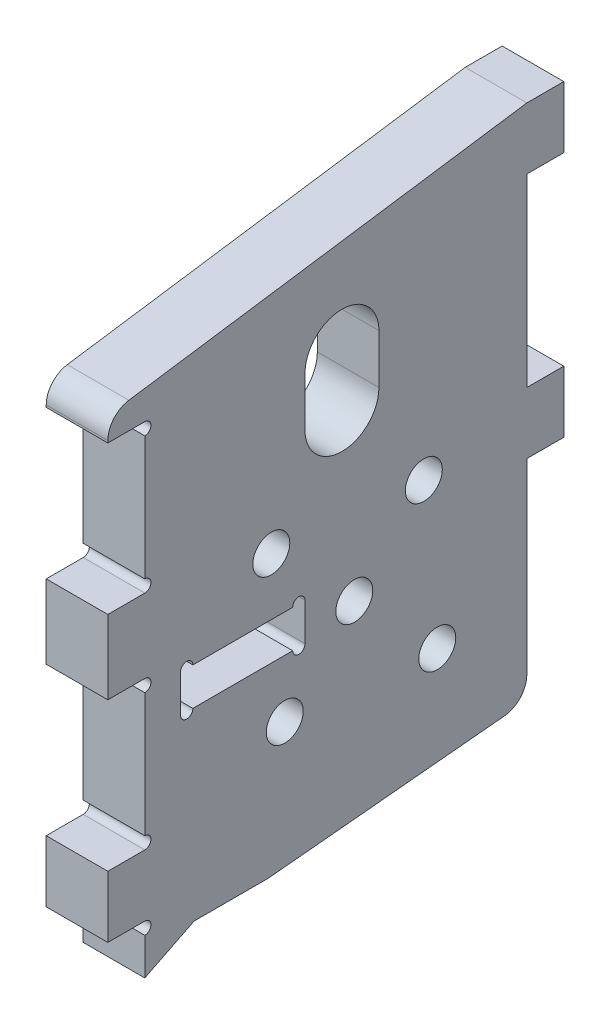
from build123d import *

# Parameters (mm, degrees)
SKETCH1_R           = 1.5
BOSS_EXTRUDE1_DEPTH = 5
SKETCH2_W           = 3
SKETCH2_H           = 12.05
SKETCH2_W_2         = 10.1
SKETCH2_H_2         = 3.05
CUT_EXTRUDE1_DEPTH  = 35.770677301
CUT_EXTRUDE3_DEPTH  = 10
BOSS_EXTRUDE3_DEPTH = 5
FILLET1_R           = 2
CUT_EXTRUDE4_DEPTH  = 5


with BuildPart() as part:
    # Sketch1 → Boss-Extrude1 (new body)
    with BuildSketch(Plane(origin=(0, 0, 0), x_dir=(0, 0, -1), z_dir=(1, 0, 0))):
        Polygon((17, 28), (17, 23), (14, 23), (14, 8), (17, 8), (17, 3), (14, 3), (14, -14), (-20, -14), (-20, 23), (14, 28), align=None)
        with Locations((-6.733876165, 6.701112728)):
            Circle(SKETCH1_R, mode=Mode.SUBTRACT)
        with Locations((-5.643042298, -5.67063256)):
            Circle(SKETCH1_R, mode=Mode.SUBTRACT)
        with Locations((6.733876165, -6.701112728)):
            Circle(SKETCH1_R, mode=Mode.SUBTRACT)
        with Locations((5.643042298, 5.67063256)):
            Circle(SKETCH1_R, mode=Mode.SUBTRACT)
        Circle(SKETCH1_R, mode=Mode.SUBTRACT)
    extrude(amount=BOSS_EXTRUDE1_DEPTH)

    # Sketch2 → Cut-Extrude1 (cut, through all)
    with BuildSketch(Plane(origin=(5, 0, 0), x_dir=(0, 0, -1), z_dir=(1, 0, 0))):
        with Locations((-18.5, 15.075)):
            Rectangle(SKETCH2_W, SKETCH2_H)
        with Locations((-9.05, 0.525)):
            Rectangle(SKETCH2_W_2, SKETCH2_H_2)
        with Locations((-18.5, -2.975)):
            Rectangle(SKETCH2_W, SKETCH2_H)
    extrude(amount=-CUT_EXTRUDE1_DEPTH, mode=Mode.SUBTRACT)

    # Sketch4 → Cut-Extrude3 (cut)
    with BuildSketch(Plane(origin=(5, 0, 0), x_dir=(0, 0, -1), z_dir=(1, 0, 0))):
        with BuildLine():
            Line((-4, 18), (-4, 14))
            ThreePointArc((-4, 14), (-1, 11), (2, 14))
            Line((2, 14), (2, 18))
            ThreePointArc((2, 18), (-1, 21), (-4, 18))
        make_face()
    extrude(amount=-CUT_EXTRUDE3_DEPTH, mode=Mode.SUBTRACT)

    # Sketch5 → Boss-Extrude3 (add)
    with BuildSketch(Plane(origin=(5, 0, 0), x_dir=(0, 0, -1), z_dir=(1, 0, 0))):
        Polygon((-7, -16), (14, -14), (-17, -14), (-17, -18), (-13, -16), align=None)
    extrude(amount=-BOSS_EXTRUDE3_DEPTH)

    # Fillet1
    fillet1_edges = [part.edges().sort_by_distance(p)[0] for p in [
        (2.5, 23, 20),
        (2.5, -14, -14),
    ]]
    fillet(fillet1_edges, radius=FILLET1_R)

    # Sketch6 → Cut-Extrude4 (cut)
    with BuildSketch(Plane(origin=(5, 0, 0), x_dir=(0, 0, -1), z_dir=(1, 0, 0))):
        with BuildLine():
            Line((-17, 21.1), (-17, 20.1))
            ThreePointArc((-17, 20.1), (-16.5, 20.6), (-17, 21.1))
        make_face()
        with BuildLine():
            Line((-17, 10.05), (-17, 9.05))
            ThreePointArc((-17, 9.05), (-16.5, 9.55), (-17, 10.05))
        make_face()
        with BuildLine():
            Line((-17, -8), (-17, -9))
            ThreePointArc((-17, -9), (-16.5, -8.5), (-17, -8))
        make_face()
        with BuildLine():
            Line((-17, 3.05), (-17, 2.05))
            ThreePointArc((-17, 2.05), (-16.5, 2.55), (-17, 3.05))
        make_face()
        with BuildLine():
            Line((-14.1, 2.05), (-13.1, 2.05))
            ThreePointArc((-13.1, 2.05), (-13.6, 2.55), (-14.1, 2.05))
        make_face()
        with BuildLine():
            Line((-13.1, -1), (-14.1, -1))
            ThreePointArc((-14.1, -1), (-13.6, -1.5), (-13.1, -1))
        make_face()
        with BuildLine():
            Line((-5, 2.05), (-4, 2.05))
            ThreePointArc((-4, 2.05), (-4.5, 2.55), (-5, 2.05))
        make_face()
        with BuildLine():
            Line((-4, -1), (-5, -1))
            ThreePointArc((-5, -1), (-4.5, -1.5), (-4, -1))
        make_face()
        with BuildLine():
            Line((-17, -14), (-17, -15))
            ThreePointArc((-17, -15), (-16.5, -14.5), (-17, -14))
        make_face()
    extrude(amount=-CUT_EXTRUDE4_DEPTH, mode=Mode.SUBTRACT)


solid = part.part
